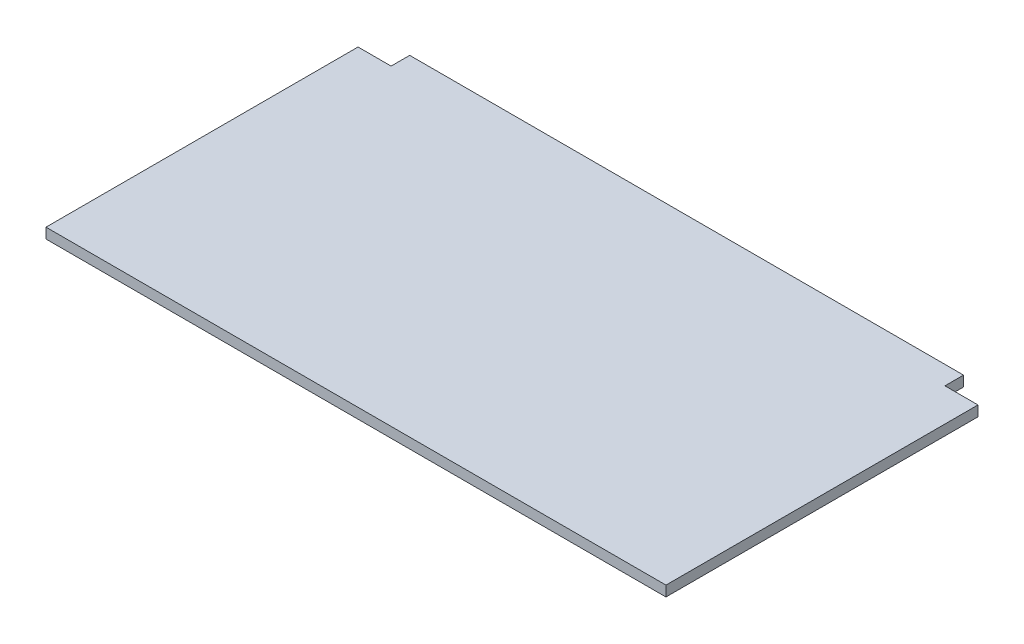
from build123d import *

# Parameters (mm, degrees)
SKETCH1_W           = 1500
SKETCH1_H           = 800
BOSS_EXTRUDE1_DEPTH = 25
SKETCH2_W           = 80
SKETCH2_H           = 45
CUT_EXTRUDE1_DEPTH  = 851.367567585


with BuildPart() as part:
    # Sketch1 → Boss-Extrude1 (new body)
    with BuildSketch(Plane(origin=(0, 0, 0), x_dir=(1, 0, 0), z_dir=(0, 1, 0))):
        Rectangle(SKETCH1_W, SKETCH1_H)
    extrude(amount=BOSS_EXTRUDE1_DEPTH)

    # Sketch2 → Cut-Extrude1 (cut, through all)
    with BuildSketch(Plane(origin=(0, 25, 0), x_dir=(1, 0, 0), z_dir=(0, 1, 0))):
        with Locations((710, 377.5)):
            Rectangle(SKETCH2_W, SKETCH2_H)
        with Locations((-710, 377.5)):
            Rectangle(SKETCH2_W, SKETCH2_H)
    extrude(amount=-CUT_EXTRUDE1_DEPTH, mode=Mode.SUBTRACT)


solid = part.part
